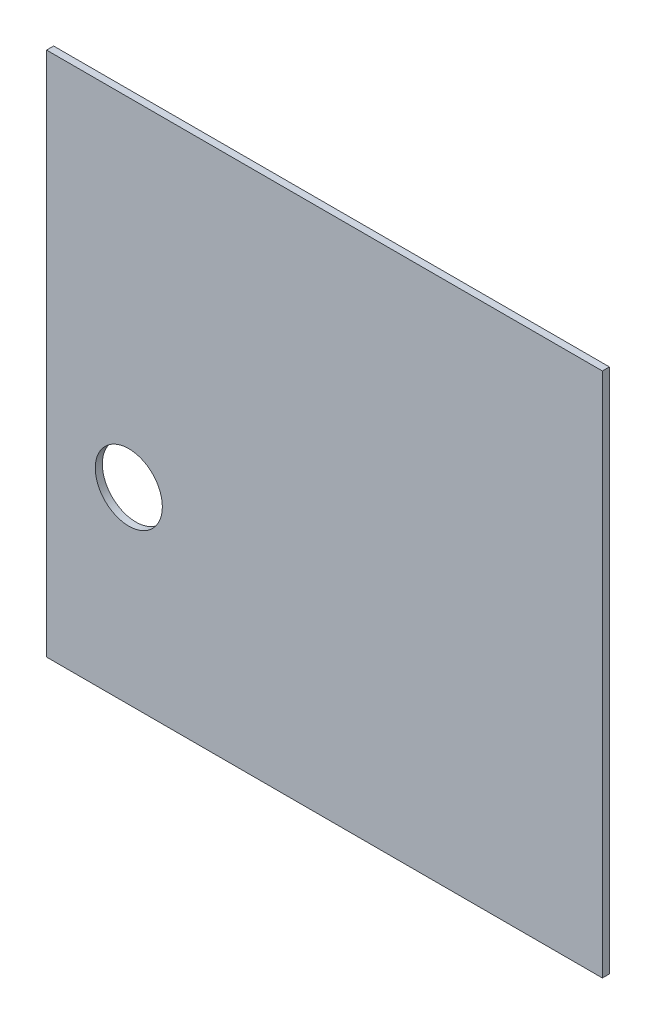
from build123d import *

# Parameters (mm, degrees)
SKETCH1_W           = 236.55
SKETCH1_H           = 223.74
BOSS_EXTRUDE1_DEPTH = 3
SKETCH2_R           = 14.275
CUT_EXTRUDE1_DEPTH  = 3


with BuildPart() as part:
    # Sketch1 → Boss-Extrude1 (new body)
    with BuildSketch(Plane.XY):
        with Locations((118.275, 111.87)):
            Rectangle(SKETCH1_W, SKETCH1_H)
    extrude(amount=BOSS_EXTRUDE1_DEPTH)

    # Sketch2 → Cut-Extrude1 (cut)
    with BuildSketch(Plane.XY.offset(3)):
        with Locations((35, 80.05)):
            Circle(SKETCH2_R)
    extrude(amount=-CUT_EXTRUDE1_DEPTH, mode=Mode.SUBTRACT)


solid = part.part
